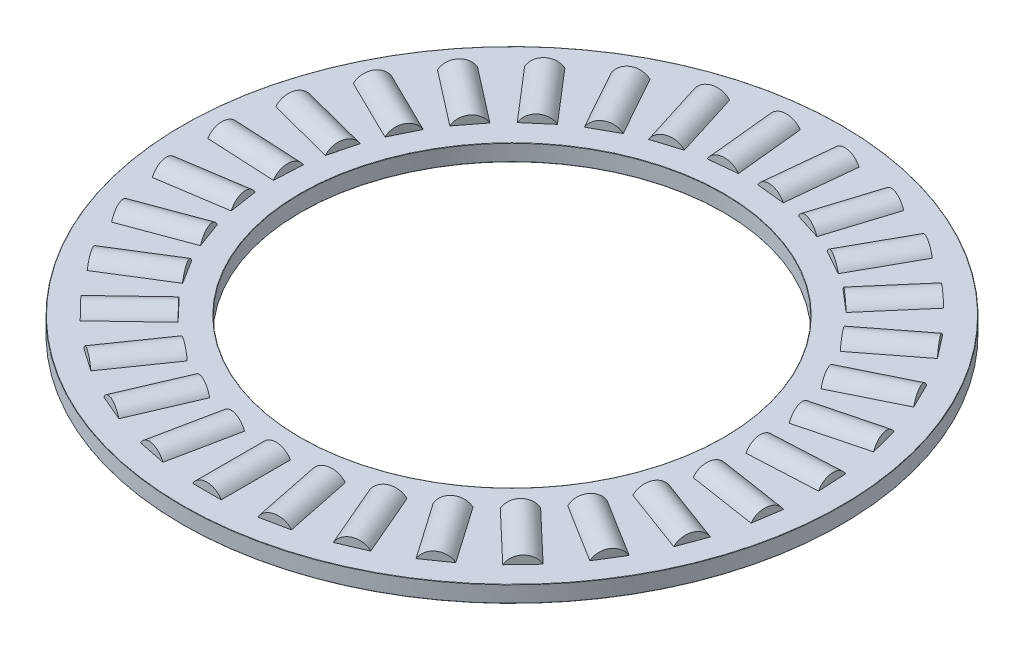
from build123d import *

# Parameters (mm, degrees)
SKETCH1_W         = 7.11835
SKETCH1_H         = 0.9921875
SKETCH3_W         = 4.1671875
SKETCH3_H         = 0.9921875
SKETCH2_W         = 4.1671875
SKETCH2_H         = 0.9921875
CIRPATTERN1_COUNT = 31
CIRPATTERN1_ANGLE = 348.387096774
CIRPATTERN2_COUNT = 31
FILLET2_R         = 0.01984375


with BuildPart() as part:
    # Sketch1 → Revolve1 (revolve)
    with BuildSketch(Plane(origin=(0, 0, 0), x_dir=(0, 0, -1), z_dir=(1, 0, 0))):
        with Locations((-16.284575, 0)):
            Rectangle(SKETCH1_W, SKETCH1_H)
    revolve(axis=Axis((0, -0.9921875, 0), (0, 1, 0)))

    # Sketch3 → Cut-Revolve1 (revolve, cut)
    with BuildSketch(Plane(origin=(0, 0, 0), x_dir=(0, 0, -1), z_dir=(1, 0, 0))):
        with Locations((-16.284575, 0.49609375)):
            Rectangle(SKETCH3_W, SKETCH3_H)
    cut_revolve1 = revolve(axis=Axis((0, 0, 18.36816875), (0, 0, -1)), mode=Mode.SUBTRACT)

    # CirPattern2: Cut-Revolve1 ×31 about axis
    cirpattern2_axis = Axis((0, 0.9921875, 0), (0, -1, 0))
    for i in range(1, CIRPATTERN2_COUNT):
        add(cut_revolve1.rotate(cirpattern2_axis, i * 360 / CIRPATTERN2_COUNT), mode=Mode.SUBTRACT)

    # Fillet2
    fillet2_edges = [part.edges().sort_by_distance(p)[0] for p in [
        (0, -0.49609375, -12.7254),
        (0, 0.49609375, -12.7254),
        (0, -0.49609375, -19.84375),
        (0, 0.49609375, -19.84375),
    ]]
    fillet(fillet2_edges, radius=FILLET2_R)


with BuildPart() as body_2:
    # Sketch2 → Revolve2 (revolve)
    with BuildSketch(Plane(origin=(0, 0, 0), x_dir=(0, 0, -1), z_dir=(1, 0, 0))):
        with Locations((-16.284575, 0.49609375)):
            Rectangle(SKETCH2_W, SKETCH2_H)
    revolve(axis=Axis((0, 0, 18.36816875), (0, 0, -1)))


with BuildPart() as cirpattern1_1:
    # CirPattern1: pattern copy
    add(body_2.part.rotate(Axis((0, 0.9921875, 0), (0, -1, 0)), 1 * CIRPATTERN1_ANGLE / (CIRPATTERN1_COUNT - 1)))


with BuildPart() as cirpattern1_2:
    # CirPattern1: pattern copy
    add(body_2.part.rotate(Axis((0, 0.9921875, 0), (0, -1, 0)), 2 * CIRPATTERN1_ANGLE / (CIRPATTERN1_COUNT - 1)))


with BuildPart() as cirpattern1_3:
    # CirPattern1: pattern copy
    add(body_2.part.rotate(Axis((0, 0.9921875, 0), (0, -1, 0)), 3 * CIRPATTERN1_ANGLE / (CIRPATTERN1_COUNT - 1)))


with BuildPart() as cirpattern1_4:
    # CirPattern1: pattern copy
    add(body_2.part.rotate(Axis((0, 0.9921875, 0), (0, -1, 0)), 4 * CIRPATTERN1_ANGLE / (CIRPATTERN1_COUNT - 1)))


with BuildPart() as cirpattern1_5:
    # CirPattern1: pattern copy
    add(body_2.part.rotate(Axis((0, 0.9921875, 0), (0, -1, 0)), 5 * CIRPATTERN1_ANGLE / (CIRPATTERN1_COUNT - 1)))


with BuildPart() as cirpattern1_6:
    # CirPattern1: pattern copy
    add(body_2.part.rotate(Axis((0, 0.9921875, 0), (0, -1, 0)), 6 * CIRPATTERN1_ANGLE / (CIRPATTERN1_COUNT - 1)))


with BuildPart() as cirpattern1_7:
    # CirPattern1: pattern copy
    add(body_2.part.rotate(Axis((0, 0.9921875, 0), (0, -1, 0)), 7 * CIRPATTERN1_ANGLE / (CIRPATTERN1_COUNT - 1)))


with BuildPart() as cirpattern1_8:
    # CirPattern1: pattern copy
    add(body_2.part.rotate(Axis((0, 0.9921875, 0), (0, -1, 0)), 8 * CIRPATTERN1_ANGLE / (CIRPATTERN1_COUNT - 1)))


with BuildPart() as cirpattern1_9:
    # CirPattern1: pattern copy
    add(body_2.part.rotate(Axis((0, 0.9921875, 0), (0, -1, 0)), 9 * CIRPATTERN1_ANGLE / (CIRPATTERN1_COUNT - 1)))


with BuildPart() as cirpattern1_10:
    # CirPattern1: pattern copy
    add(body_2.part.rotate(Axis((0, 0.9921875, 0), (0, -1, 0)), 10 * CIRPATTERN1_ANGLE / (CIRPATTERN1_COUNT - 1)))


with BuildPart() as cirpattern1_11:
    # CirPattern1: pattern copy
    add(body_2.part.rotate(Axis((0, 0.9921875, 0), (0, -1, 0)), 11 * CIRPATTERN1_ANGLE / (CIRPATTERN1_COUNT - 1)))


with BuildPart() as cirpattern1_12:
    # CirPattern1: pattern copy
    add(body_2.part.rotate(Axis((0, 0.9921875, 0), (0, -1, 0)), 12 * CIRPATTERN1_ANGLE / (CIRPATTERN1_COUNT - 1)))


with BuildPart() as cirpattern1_13:
    # CirPattern1: pattern copy
    add(body_2.part.rotate(Axis((0, 0.9921875, 0), (0, -1, 0)), 13 * CIRPATTERN1_ANGLE / (CIRPATTERN1_COUNT - 1)))


with BuildPart() as cirpattern1_14:
    # CirPattern1: pattern copy
    add(body_2.part.rotate(Axis((0, 0.9921875, 0), (0, -1, 0)), 14 * CIRPATTERN1_ANGLE / (CIRPATTERN1_COUNT - 1)))


with BuildPart() as cirpattern1_15:
    # CirPattern1: pattern copy
    add(body_2.part.rotate(Axis((0, 0.9921875, 0), (0, -1, 0)), 15 * CIRPATTERN1_ANGLE / (CIRPATTERN1_COUNT - 1)))


with BuildPart() as cirpattern1_16:
    # CirPattern1: pattern copy
    add(body_2.part.rotate(Axis((0, 0.9921875, 0), (0, -1, 0)), 16 * CIRPATTERN1_ANGLE / (CIRPATTERN1_COUNT - 1)))


with BuildPart() as cirpattern1_17:
    # CirPattern1: pattern copy
    add(body_2.part.rotate(Axis((0, 0.9921875, 0), (0, -1, 0)), 17 * CIRPATTERN1_ANGLE / (CIRPATTERN1_COUNT - 1)))


with BuildPart() as cirpattern1_18:
    # CirPattern1: pattern copy
    add(body_2.part.rotate(Axis((0, 0.9921875, 0), (0, -1, 0)), 18 * CIRPATTERN1_ANGLE / (CIRPATTERN1_COUNT - 1)))


with BuildPart() as cirpattern1_19:
    # CirPattern1: pattern copy
    add(body_2.part.rotate(Axis((0, 0.9921875, 0), (0, -1, 0)), 19 * CIRPATTERN1_ANGLE / (CIRPATTERN1_COUNT - 1)))


with BuildPart() as cirpattern1_20:
    # CirPattern1: pattern copy
    add(body_2.part.rotate(Axis((0, 0.9921875, 0), (0, -1, 0)), 20 * CIRPATTERN1_ANGLE / (CIRPATTERN1_COUNT - 1)))


with BuildPart() as cirpattern1_21:
    # CirPattern1: pattern copy
    add(body_2.part.rotate(Axis((0, 0.9921875, 0), (0, -1, 0)), 21 * CIRPATTERN1_ANGLE / (CIRPATTERN1_COUNT - 1)))


with BuildPart() as cirpattern1_22:
    # CirPattern1: pattern copy
    add(body_2.part.rotate(Axis((0, 0.9921875, 0), (0, -1, 0)), 22 * CIRPATTERN1_ANGLE / (CIRPATTERN1_COUNT - 1)))


with BuildPart() as cirpattern1_23:
    # CirPattern1: pattern copy
    add(body_2.part.rotate(Axis((0, 0.9921875, 0), (0, -1, 0)), 23 * CIRPATTERN1_ANGLE / (CIRPATTERN1_COUNT - 1)))


with BuildPart() as cirpattern1_24:
    # CirPattern1: pattern copy
    add(body_2.part.rotate(Axis((0, 0.9921875, 0), (0, -1, 0)), 24 * CIRPATTERN1_ANGLE / (CIRPATTERN1_COUNT - 1)))


with BuildPart() as cirpattern1_25:
    # CirPattern1: pattern copy
    add(body_2.part.rotate(Axis((0, 0.9921875, 0), (0, -1, 0)), 25 * CIRPATTERN1_ANGLE / (CIRPATTERN1_COUNT - 1)))


with BuildPart() as cirpattern1_26:
    # CirPattern1: pattern copy
    add(body_2.part.rotate(Axis((0, 0.9921875, 0), (0, -1, 0)), 26 * CIRPATTERN1_ANGLE / (CIRPATTERN1_COUNT - 1)))


with BuildPart() as cirpattern1_27:
    # CirPattern1: pattern copy
    add(body_2.part.rotate(Axis((0, 0.9921875, 0), (0, -1, 0)), 27 * CIRPATTERN1_ANGLE / (CIRPATTERN1_COUNT - 1)))


with BuildPart() as cirpattern1_28:
    # CirPattern1: pattern copy
    add(body_2.part.rotate(Axis((0, 0.9921875, 0), (0, -1, 0)), 28 * CIRPATTERN1_ANGLE / (CIRPATTERN1_COUNT - 1)))


with BuildPart() as cirpattern1_29:
    # CirPattern1: pattern copy
    add(body_2.part.rotate(Axis((0, 0.9921875, 0), (0, -1, 0)), 29 * CIRPATTERN1_ANGLE / (CIRPATTERN1_COUNT - 1)))


with BuildPart() as cirpattern1_30:
    # CirPattern1: pattern copy
    add(body_2.part.rotate(Axis((0, 0.9921875, 0), (0, -1, 0)), 30 * CIRPATTERN1_ANGLE / (CIRPATTERN1_COUNT - 1)))


solid = Compound([part.part, body_2.part, cirpattern1_1.part, cirpattern1_2.part, cirpattern1_3.part, cirpattern1_4.part, cirpattern1_5.part, cirpattern1_6.part, cirpattern1_7.part, cirpattern1_8.part, cirpattern1_9.part, cirpattern1_10.part, cirpattern1_11.part, cirpattern1_12.part, cirpattern1_13.part, cirpattern1_14.part, cirpattern1_15.part, cirpattern1_16.part, cirpattern1_17.part, cirpattern1_18.part, cirpattern1_19.part, cirpattern1_20.part, cirpattern1_21.part, cirpattern1_22.part, cirpattern1_23.part, cirpattern1_24.part, cirpattern1_25.part, cirpattern1_26.part, cirpattern1_27.part, cirpattern1_28.part, cirpattern1_29.part, cirpattern1_30.part])
